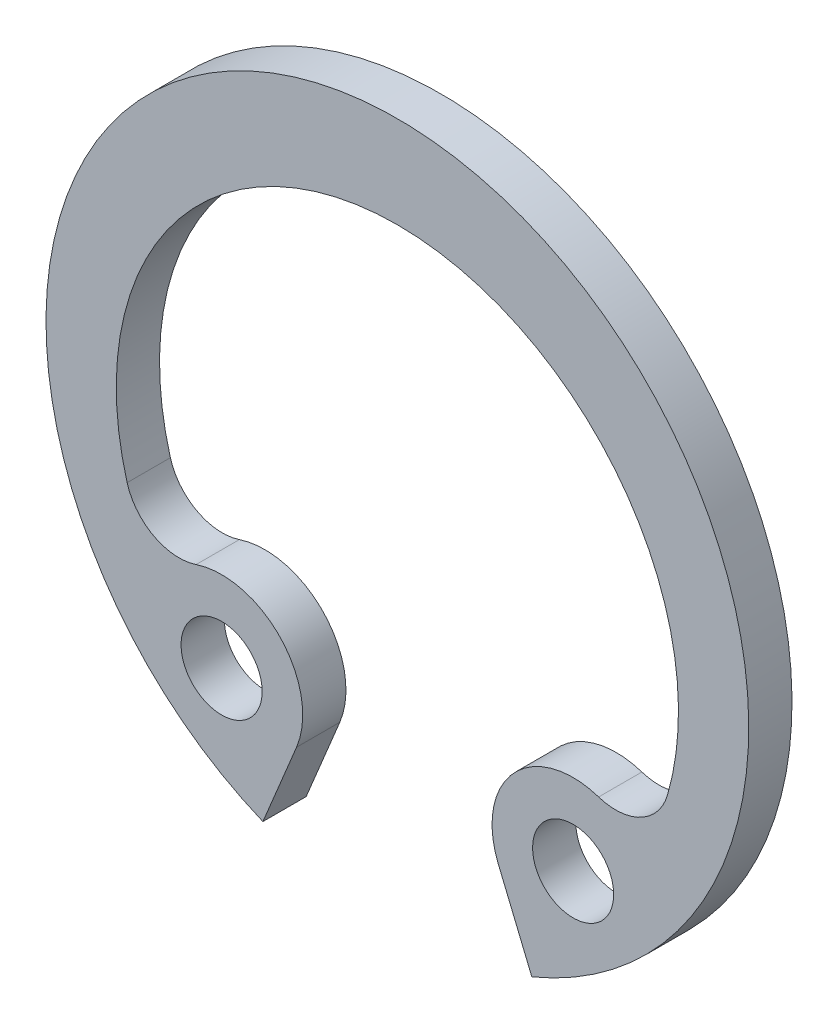
from build123d import *

# Parameters (mm, degrees)
SKETCH1_R  = 0.75
BODY_DEPTH = 0.8


with BuildPart() as part:
    # Sketch1 → Body (new body)
    with BuildSketch(Plane.XY):
        with BuildLine():
            Line((1.865360941, -4.503379682), (2.48744231, -6.005216961))
            ThreePointArc((2.48744231, -6.005216961), (0, 6.5), (-2.48744231, -6.005216961))
            Line((-2.48744231, -6.005216961), (-1.865360941, -4.503379682))
            ThreePointArc((-1.865360941, -4.503379682), (-2.152695679, -2.907918451), (-3.723088598, -2.5055208))
            ThreePointArc((-3.723088598, -2.5055208), (-4.504717999, -2.440543041), (-4.999049926, -1.831607432))
            ThreePointArc((-4.999049926, -1.831607432), (0, 4.8), (4.999049926, -1.831607432))
            ThreePointArc((4.999049926, -1.831607432), (4.504717999, -2.440543041), (3.723088598, -2.5055208))
            ThreePointArc((3.723088598, -2.5055208), (2.152695679, -2.907918451), (1.865360941, -4.503379682))
        make_face()
        with Locations((3.25118024, -3.929354533)):
            Circle(SKETCH1_R, mode=Mode.SUBTRACT)
        with Locations((-3.25118024, -3.929354533)):
            Circle(SKETCH1_R, mode=Mode.SUBTRACT)
    extrude(amount=-BODY_DEPTH)


solid = part.part
